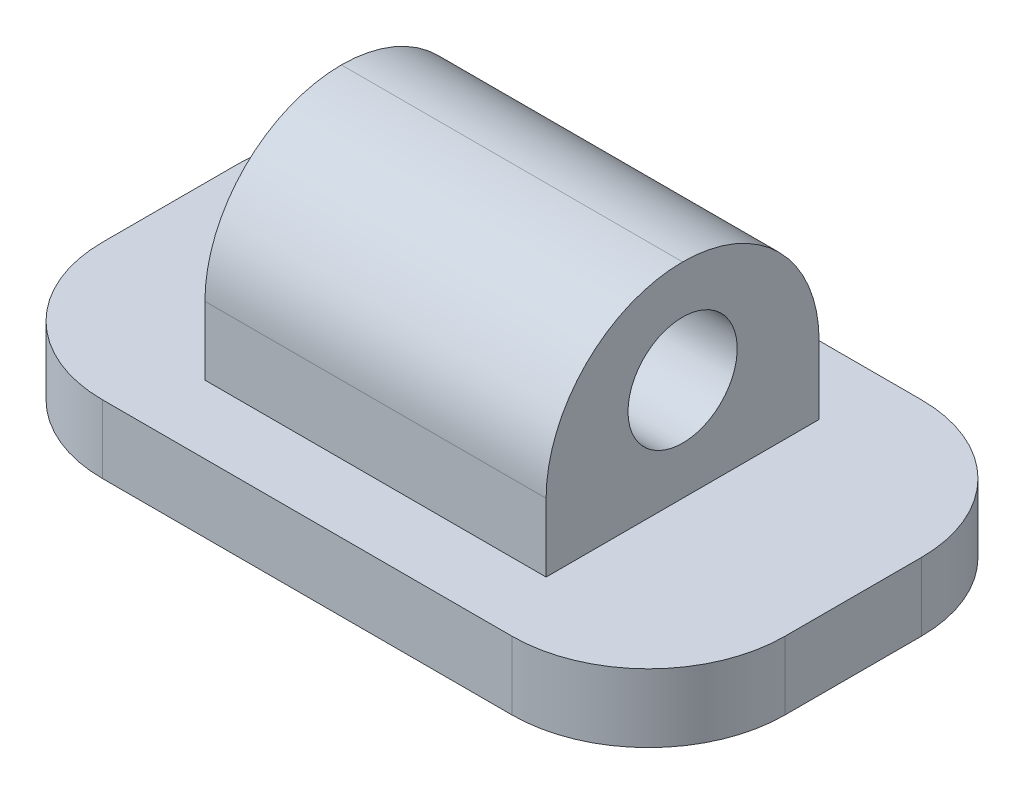
from build123d import *

# Parameters (mm, degrees)
SZKIC1_W                    = 50
SZKIC1_H                    = 30
DODANIE_WYCI_GNI_CIE1_DEPTH = 5
ZAOKR_GLENIE1_R             = 10
SZKIC2_W                    = 25
SZKIC2_H                    = 20
DODANIE_WYCI_GNI_CIE2_DEPTH = 15
SZKIC3_R                    = 4
WYTNIJ_WYCI_GNI_CIE1_DEPTH  = 30
ZAOKR_GLENIE2_R             = 10


with BuildPart() as part:
    # Szkic1 → Dodanie-wyciągnięcie1 (new body)
    with BuildSketch(Plane(origin=(0, 0, 0), x_dir=(1, 0, 0), z_dir=(0, 1, 0))):
        Rectangle(SZKIC1_W, SZKIC1_H)
    extrude(amount=DODANIE_WYCI_GNI_CIE1_DEPTH)

    # Zaokrąglenie1
    zaokr_glenie1_edges = [part.edges().sort_by_distance(p)[0] for p in [
        (25, 2.5, 15),
        (-25, 2.5, 15),
        (-25, 2.5, -15),
        (25, 2.5, -15),
    ]]
    fillet(zaokr_glenie1_edges, radius=ZAOKR_GLENIE1_R)

    # Szkic2 → Dodanie-wyciągnięcie2 (add)
    with BuildSketch(Plane(origin=(0, 5, 0), x_dir=(1, 0, 0), z_dir=(0, 1, 0))):
        Rectangle(SZKIC2_W, SZKIC2_H)
    extrude(amount=DODANIE_WYCI_GNI_CIE2_DEPTH)

    # Szkic3 → Wytnij-wyciągnięcie1 (cut)
    with BuildSketch(Plane.ZY.offset(12.5)):
        with Locations((0, 12.5)):
            Circle(SZKIC3_R)
    extrude(amount=-WYTNIJ_WYCI_GNI_CIE1_DEPTH, mode=Mode.SUBTRACT)

    # Zaokrąglenie2
    zaokr_glenie2_edges = [part.edges().sort_by_distance(p)[0] for p in [
        (0, 20, 10),
        (0, 20, -10),
    ]]
    fillet(zaokr_glenie2_edges, radius=ZAOKR_GLENIE2_R - 0.0001)  # a hair under: the kernel refuses the full size


solid = part.part
